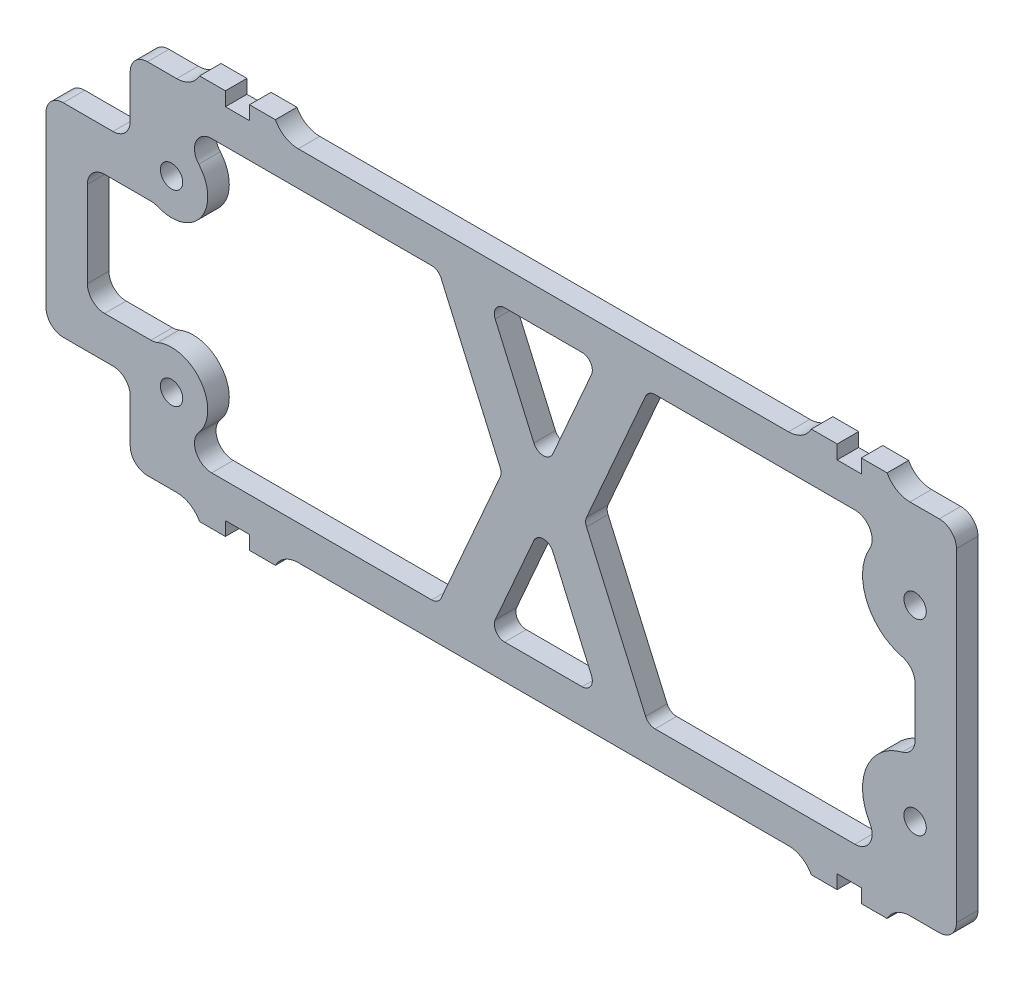
from build123d import *

# Parameters (mm, degrees)
SKETCH1_R           = 0.824992
BOSS_EXTRUDE1_DEPTH = 1.5875
FILLET4_R           = 0.762
FILLET5_R           = 1.27
FILLET6_R           = 1.905


with BuildPart() as part:
    # Sketch1 → Boss-Extrude1 (new body)
    with BuildSketch(Plane.XY):
        Polygon((-7.7520038, 24.7080024), (-12.8634998, 24.7080024), (-12.8634998, 25.7240024), (-14.7684998, 25.7240024), (-14.7684998, 24.7080024), (-16.5464998, 24.7080024), (-16.5464998, 25.7240024), (-18.4514998, 25.7240024), (-18.4514998, 24.7080024), (-38.1999998, 24.7080024), (-57.9484998, 24.7080024), (-57.9484998, 25.7240024), (-59.8534998, 25.7240024), (-59.8534998, 24.7080024), (-61.6314998, 24.7080024), (-61.6314998, 25.7240024), (-63.5364998, 25.7240024), (-63.5364998, 24.7080024), (-68.6479958, 24.7080024), (-68.6479958, 18.9868048), (-74.8538, 18.9868048), (-74.8538, 11.5000024), (-74.8538, 4.0132), (-68.6479958, 4.0132), (-68.6479958, -1.7079976), (-63.5364998, -1.7079976), (-63.5364998, -2.7239976), (-61.6314998, -2.7239976), (-61.6314998, -1.7079976), (-59.8534998, -1.7079976), (-59.8534998, -2.7239976), (-57.9484998, -2.7239976), (-57.9484998, -1.7079976), (-38.1999998, -1.7079976), (-18.4514998, -1.7079976), (-18.4514998, -2.7239976), (-16.5464998, -2.7239976), (-16.5464998, -1.7079976), (-14.7684998, -1.7079976), (-14.7684998, -2.7239976), (-12.8634998, -2.7239976), (-12.8634998, -1.7079976), (-7.7520038, -1.7079976), (-7.7520038, 11.5000024), align=None)
        with Locations((-10.8000038, 18.2999888)):
            Circle(SKETCH1_R, mode=Mode.SUBTRACT)
        with Locations((-10.8000038, 4.499991)):
            Circle(SKETCH1_R, mode=Mode.SUBTRACT)
        with Locations((-65.5999958, 18.2999888)):
            Circle(SKETCH1_R, mode=Mode.SUBTRACT)
        with Locations((-65.5999958, 4.499991)):
            Circle(SKETCH1_R, mode=Mode.SUBTRACT)
        with BuildLine():
            Line((-68.6479958, 15.9388048), (-71.8058, 15.9388048))
            Line((-71.8058, 15.9388048), (-71.8058, 11.5000024))
            Line((-71.8058, 11.5000024), (-71.8058, 7.0612))
            Line((-71.8058, 7.0612), (-68.6479958, 7.0612))
            Line((-68.6479958, 7.0612), (-67.121334605, 7.0612))
            ThreePointArc((-67.121334605, 7.0612), (-66.871048858, 7.086106813), (-66.630580151, 7.159850323))
            ThreePointArc((-66.630580151, 7.159850323), (-63.434712075, 6.257075855), (-63.596128623, 2.940071303))
            ThreePointArc((-63.596128623, 2.940071303), (-63.798895247, 1.578288502), (-62.641906157, 0.8320024))
            Line((-62.641906157, 0.8320024), (-45.934562137, 0.8320024))
            Line((-45.934562137, 0.8320024), (-41.2479998, 11.5000024))
            Line((-41.2479998, 11.5000024), (-45.934562137, 22.1680024))
            Line((-45.934562137, 22.1680024), (-62.641906157, 22.1680024))
            ThreePointArc((-62.641906157, 22.1680024), (-63.798895247, 21.421716298), (-63.596128623, 20.059933497))
            ThreePointArc((-63.596128623, 20.059933497), (-63.434712075, 16.742928945), (-66.630580151, 15.840154477))
            ThreePointArc((-66.630580151, 15.840154477), (-66.871048858, 15.913897987), (-67.121334605, 15.9388048))
            Line((-67.121334605, 15.9388048), (-68.6479958, 15.9388048))
        make_face(mode=Mode.SUBTRACT)
        with BuildLine():
            Line((-10.8000038, 13.316268632), (-10.8000038, 9.683736168))
            ThreePointArc((-10.8000038, 9.683736168), (-11.067211137, 8.904437204), (-11.756392579, 8.453066431))
            ThreePointArc((-11.756392579, 8.453066431), (-14.373483224, 6.193438859), (-14.142504388, 2.743550602))
            ThreePointArc((-14.142504388, 2.743550602), (-14.136809019, 1.470284986), (-15.238549964, 0.8320024))
            Line((-15.238549964, 0.8320024), (-30.465437463, 0.8320024))
            Line((-30.465437463, 0.8320024), (-35.1519998, 11.5000024))
            Line((-35.1519998, 11.5000024), (-30.465437463, 22.1680024))
            Line((-30.465437463, 22.1680024), (-15.238549964, 22.1680024))
            ThreePointArc((-15.238549964, 22.1680024), (-14.136809019, 21.529719814), (-14.142504388, 20.256454198))
            ThreePointArc((-14.142504388, 20.256454198), (-14.373483224, 16.806565941), (-11.756392579, 14.546938369))
            ThreePointArc((-11.756392579, 14.546938369), (-11.067211137, 14.095567596), (-10.8000038, 13.316268632))
        make_face(mode=Mode.SUBTRACT)
        Polygon((-42.217053232, 22.1680024), (-38.1999998, 13.0240024), (-34.182946368, 22.1680024), align=None, mode=Mode.SUBTRACT)
        Polygon((-34.182946368, 0.8320024), (-38.1999998, 9.9760024), (-42.217053232, 0.8320024), align=None, mode=Mode.SUBTRACT)
    extrude(amount=BOSS_EXTRUDE1_DEPTH)

    # Fillet4
    fillet4_edges = [part.edges().sort_by_distance(p)[0] for p in [
        (-34.182946368, 22.1680024, 0.79375),
        (-42.217053232, 22.1680024, 0.79375),
        (-38.1999998, 13.0240024, 0.79375),
        (-45.934562137, 0.8320024, 0.79375),
        (-41.2479998, 11.5000024, 0.79375),
        (-45.934562137, 22.1680024, 0.79375),
        (-30.465437463, 22.1680024, 0.79375),
        (-35.1519998, 11.5000024, 0.79375),
        (-30.465437463, 0.8320024, 0.79375),
        (-42.217053232, 0.8320024, 0.79375),
        (-34.182946368, 0.8320024, 0.79375),
        (-38.1999998, 9.9760024, 0.79375),
    ]]
    fillet(fillet4_edges, radius=FILLET4_R)

    # Fillet5
    fillet5_edges = [part.edges().sort_by_distance(p)[0] for p in [
        (-71.8058, 15.9388048, 0.79375),
        (-71.8058, 7.0612, 0.79375),
        (-7.7520038, -1.7079976, 0.79375),
        (-68.6479958, -1.7079976, 0.79375),
        (-68.6479958, 4.0132, 0.79375),
        (-74.8538, 4.0132, 0.79375),
        (-74.8538, 18.9868048, 0.79375),
        (-68.6479958, 18.9868048, 0.79375),
        (-68.6479958, 24.7080024, 0.79375),
        (-7.7520038, 24.7080024, 0.79375),
    ]]
    fillet(fillet5_edges, radius=FILLET5_R)

    # Fillet6
    # the kernel refuses this fillet: 1.905 mm, written as the material it adds along each edge
    with BuildSketch(Plane(origin=(-18.4514998, -1.7079976, 0), x_dir=(0, -1, 0), z_dir=(0, 0, 1)), Plane(origin=(-63.5364998, -1.7079976, 0), x_dir=(0, -1, 0), z_dir=(0, 0, 1))) as fillet6_piece_1:
        with BuildLine():
            CenterArc((1.905, -1.684845394), FILLET6_R, 117.818139285, 62.181860715)
            Line((0, -1.684845394), (-0.0381, -1.684845394))
            Line((-0.0381, -1.684845394), (-0.0381, 0))
            Line((-0.0381, 0), (0, 0.0381))
            ThreePointArc((0, 0.0381), (0.508, 0.0381), (0.99822, 0.033696908))
            Line((0.99822, 0.033696908), (1.016, 0))
        make_face()
    extrude(amount=1.5875)
    with BuildSketch(Plane(origin=(-12.8634998, -1.7079976, 0), x_dir=(1, 0, 0), z_dir=(0, 0, 1)), Plane(origin=(-57.9484998, -1.7079976, 0), x_dir=(1, 0, 0), z_dir=(0, 0, 1))) as fillet6_piece_2:
        with BuildLine():
            CenterArc((1.684845394, -1.905), FILLET6_R, 90, 62.181860715)
            Line((0, -1.016), (-0.033696908, -0.99822))
            ThreePointArc((-0.033696908, -0.99822), (-0.0381, -0.508), (-0.0381, 0))
            Line((-0.0381, 0), (0, 0.0381))
            Line((0, 0.0381), (1.684845394, 0.0381))
            Line((1.684845394, 0.0381), (1.684845394, 0))
        make_face()
    extrude(amount=1.5875)
    with BuildSketch(Plane(origin=(-18.4514998, 24.7080024, 0), x_dir=(0, 1, 0), z_dir=(0, 0, 1)), Plane(origin=(-63.5364998, 24.7080024, 0), x_dir=(0, 1, 0), z_dir=(0, 0, 1))) as fillet6_piece_3:
        with BuildLine():
            CenterArc((1.905, 1.684845394), FILLET6_R, 180, 62.181860715)
            Line((0, 1.684845394), (-0.0381, 1.684845394))
            Line((-0.0381, 1.684845394), (-0.0381, 0))
            Line((-0.0381, 0), (0, -0.0381))
            ThreePointArc((0, -0.0381), (0.508, -0.0381), (0.99822, -0.033696908))
            Line((0.99822, -0.033696908), (1.016, 0))
        make_face()
    extrude(amount=1.5875)
    with BuildSketch(Plane(origin=(-12.8634998, 24.7080024, 0), x_dir=(1, 0, 0), z_dir=(0, 0, 1)), Plane(origin=(-57.9484998, 24.7080024, 0), x_dir=(1, 0, 0), z_dir=(0, 0, 1))) as fillet6_piece_4:
        with BuildLine():
            CenterArc((1.684845394, 1.905), FILLET6_R, 207.818139285, 62.181860715)
            Line((0, 1.016), (-0.033696908, 0.99822))
            ThreePointArc((-0.033696908, 0.99822), (-0.0381, 0.508), (-0.0381, 0))
            Line((-0.0381, 0), (0, -0.0381))
            Line((0, -0.0381), (1.684845394, -0.0381))
            Line((1.684845394, -0.0381), (1.684845394, 0))
        make_face()
    extrude(amount=1.5875)


solid = part.part
